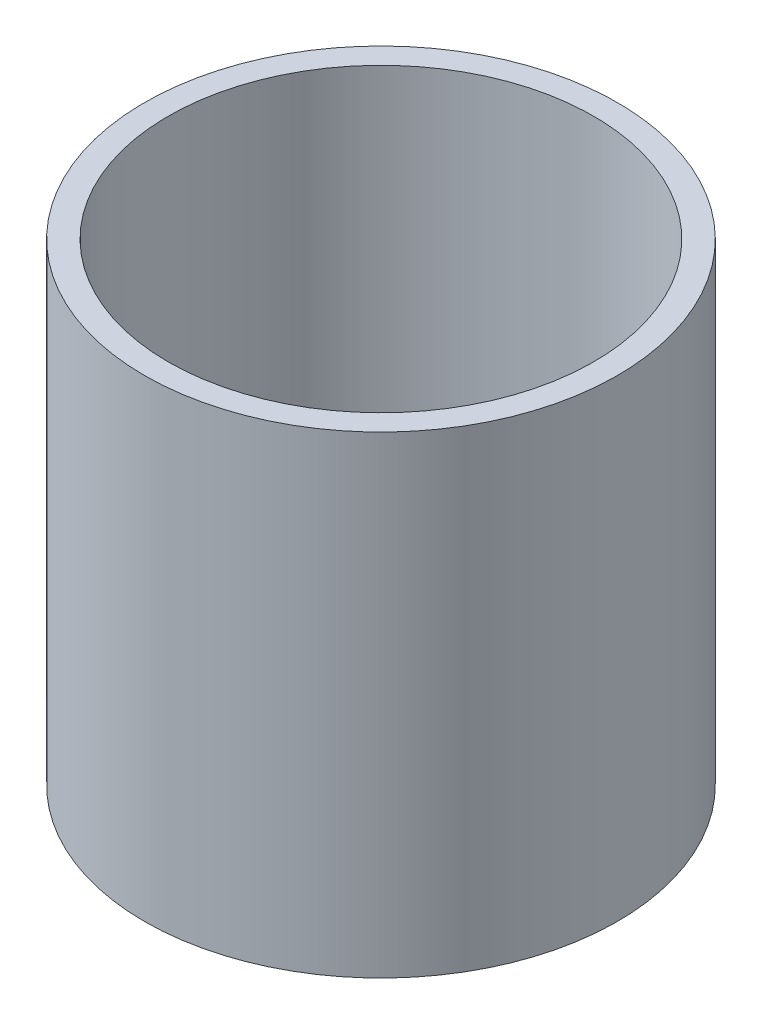
from build123d import *

# Parameters (mm, degrees)
SKETCH1_R           = 1250
SKETCH1_R_2         = 1125
BOSS_EXTRUDE1_DEPTH = 2500


with BuildPart() as part:
    # Sketch1 → Boss-Extrude1 (new body)
    with BuildSketch(Plane(origin=(0, 0, 0), x_dir=(1, 0, 0), z_dir=(0, 1, 0))):
        Circle(SKETCH1_R)
        Circle(SKETCH1_R_2, mode=Mode.SUBTRACT)
    extrude(amount=BOSS_EXTRUDE1_DEPTH)


solid = part.part
